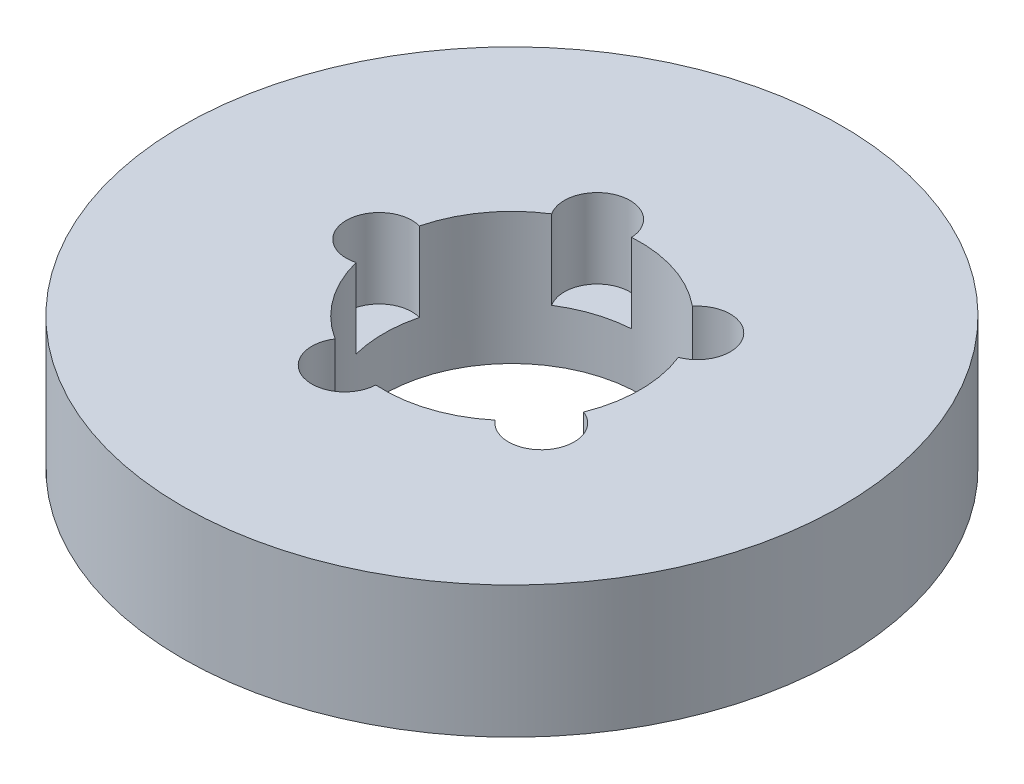
from build123d import *

# Parameters (mm, degrees)
SKETCH1_R           = 45
BOSS_EXTRUDE1_DEPTH = 18
SKETCH2_R           = 17.5
CUT_EXTRUDE1_DEPTH  = 67.136223055
SKETCH3_R           = 4.483366808
CUT_EXTRUDE2_DEPTH  = 10.81917185
CIRPATTERN1_COUNT   = 5


with BuildPart() as part:
    # Sketch1 → Boss-Extrude1 (new body)
    with BuildSketch(Plane(origin=(0, 0, 0), x_dir=(1, 0, 0), z_dir=(0, 1, 0))):
        Circle(SKETCH1_R)
    extrude(amount=BOSS_EXTRUDE1_DEPTH)

    # Sketch2 → Cut-Extrude1 (cut, through all)
    with BuildSketch(Plane(origin=(0, 0, 0), x_dir=(1, 0, 0), z_dir=(0, 1, 0))):
        Circle(SKETCH2_R)
    extrude(amount=CUT_EXTRUDE1_DEPTH, mode=Mode.SUBTRACT)

    # Sketch3 → Cut-Extrude2 (cut)
    with BuildSketch(Plane(origin=(0, 18, 0), x_dir=(1, 0, 0), z_dir=(0, 1, 0))):
        with Locations((-18.126359737, 0)):
            Circle(SKETCH3_R)
    cut_extrude2 = extrude(amount=-CUT_EXTRUDE2_DEPTH, mode=Mode.SUBTRACT)

    # CirPattern1: Cut-Extrude2 ×5 about axis
    cirpattern1_axis = Axis((0, 0, 0), (0, 1, 0))
    for i in range(1, CIRPATTERN1_COUNT):
        add(cut_extrude2.rotate(cirpattern1_axis, i * 360 / CIRPATTERN1_COUNT), mode=Mode.SUBTRACT)


solid = part.part
